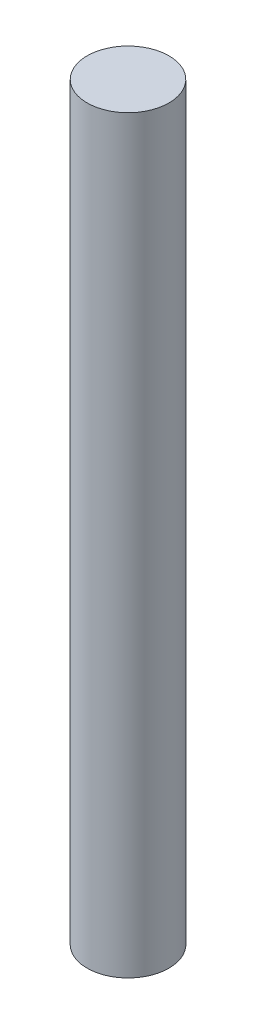
from build123d import *


with BuildPart() as part:
    # Sketch1 → Revolve1 (revolve)
    with BuildSketch(Plane.XY):
        Polygon((0, 0), (-3, 0), (-3, -27), (-3, -28.271829467), (-3, -55), (0, -55), align=None)
    revolve(axis=Axis((0, -55, 0), (0, 1, 0)))


solid = part.part
